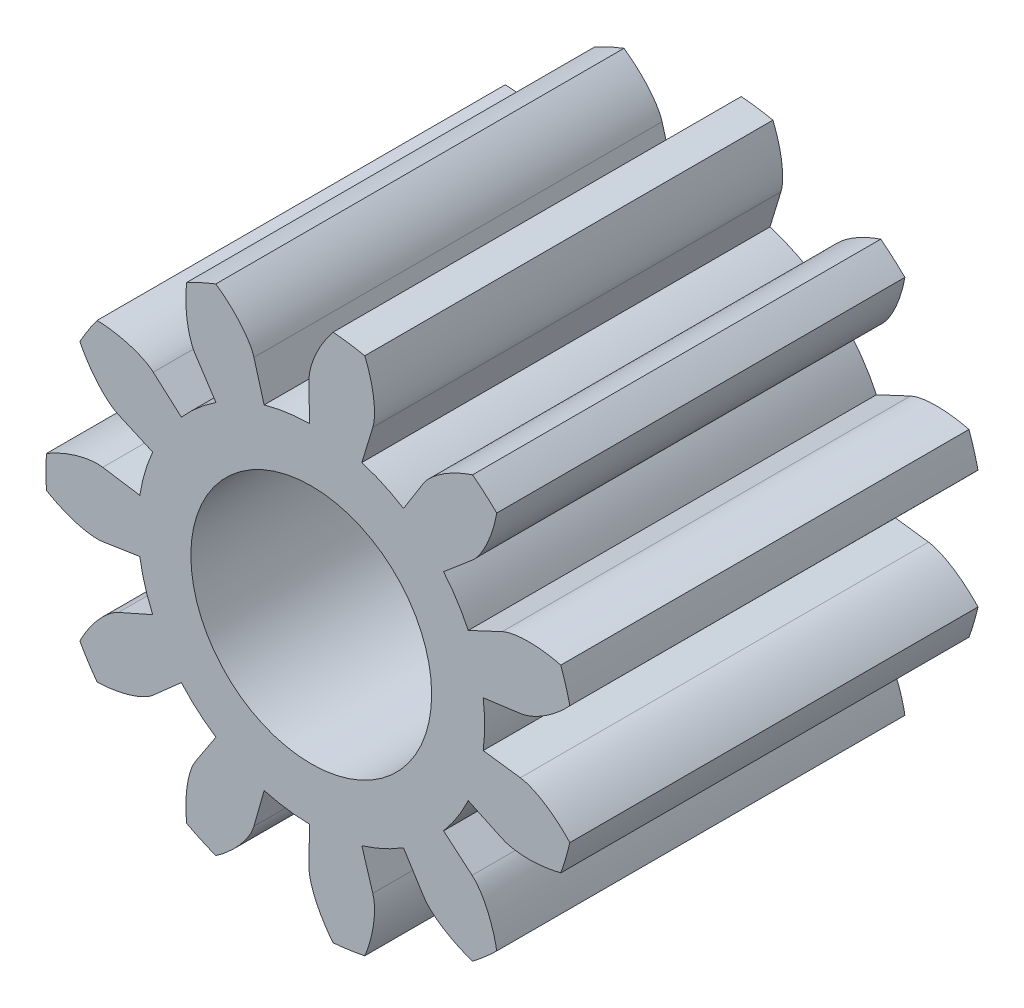
from build123d import *

# Parameters (mm, degrees)
SKETCH_1_R               = 3.25
SKETCH_1_R_2             = 1.475
EXTRUDE_1_DEPTH          = 5
CUT_EXTRUDE_1_DEPTH      = 7.791538854
PATTERN_CIRCULAR_1_COUNT = 11
PATTERN_CIRCULAR_1_ANGLE = 327.272727273


with BuildPart() as part:
    # 草图1 → 凸台-拉伸1 (new body)
    with BuildSketch(Plane.XY):
        Circle(SKETCH_1_R)
        Circle(SKETCH_1_R_2, mode=Mode.SUBTRACT)
    extrude(amount=EXTRUDE_1_DEPTH)

    # 草图1<3> → 切除-拉伸1 (cut, through all)
    with BuildSketch(Plane.XY):
        with BuildLine():
            Line((2.561576998, 0.340850163), (2.106433917, 0.280287629))
            ThreePointArc((2.106433917, 0.280287629), (2.120353399, 0.140450929), (2.125, 0))
            ThreePointArc((2.125, 0), (2.120353399, -0.140450929), (2.106433917, -0.280287629))
            Line((2.106433917, -0.280287629), (2.561576998, -0.340850163))
            add(Edge.make_bspline(
                [(2.561576998, -0.340850163), (2.581103207, -0.343448371), (2.635054327, -0.354757364), (2.733884324, -0.392277143), (2.884182106, -0.474481851), (3.013710103, -0.574261175), (3.106628538, -0.661455643), (3.160080082, -0.717308425), (3.167950842, -0.725663463)],
                knots=[0, 0, 0, 0, 0, 0.005604068, 0.015718248, 0.029959916, 0.048733667, 0.052007327, 0.052007327, 0.052007327, 0.052007327, 0.052007327], degree=4))
            ThreePointArc((3.167950842, -0.725663463), (3.229422567, -0.365143645), (3.25, 0))
            ThreePointArc((3.25, 0), (3.229422567, 0.365143645), (3.167950842, 0.725663463))
            add(Edge.make_bspline(
                [(2.561576998, 0.340850163), (2.581103207, 0.343448371), (2.635054327, 0.354757364), (2.733884324, 0.392277143), (2.884182106, 0.474481851), (3.013710103, 0.574261175), (3.106628538, 0.661455643), (3.160080082, 0.717308425), (3.167950842, 0.725663463)],
                knots=[0, 0, 0, 0, 0, 0.005604068, 0.015718248, 0.029959916, 0.048733667, 0.052007327, 0.052007327, 0.052007327, 0.052007327, 0.052007327], degree=4))
        make_face()
    cut_extrude_1 = extrude(amount=CUT_EXTRUDE_1_DEPTH, mode=Mode.SUBTRACT)

    # 阵列(圆周)1: 切除-拉伸1 ×11 about axis
    pattern_circular_1_axis = Axis((0, 0, 5), (0, 0, 1))
    for i in range(1, PATTERN_CIRCULAR_1_COUNT):
        add(cut_extrude_1.rotate(pattern_circular_1_axis, i * PATTERN_CIRCULAR_1_ANGLE / (PATTERN_CIRCULAR_1_COUNT - 1)), mode=Mode.SUBTRACT)


solid = part.part
